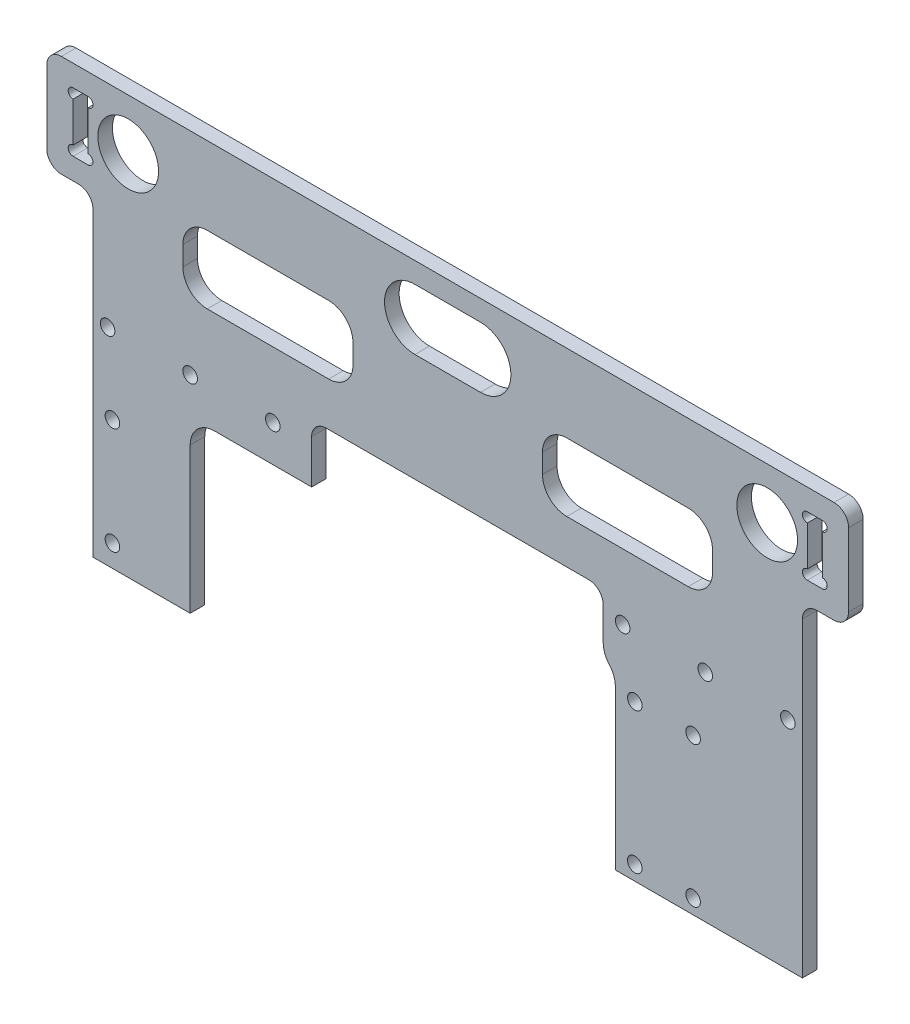
from build123d import *

# Parameters (mm, degrees)
SKETCH_1_W          = 165
SKETCH_1_H          = 51
EXTRUDE_1_DEPTH     = 3
SKETCH_2_R          = 1.5
CUT_EXTRUDE_1_DEPTH = 87.403124943
SKETCH_3_R          = 6.25
SKETCH_3_W          = 3.1
SKETCH_3_H          = 12.2
CUT_EXTRUDE_2_DEPTH = 87.403124943
SKETCH_5_W          = 9.5
SKETCH_5_H          = 30
CUT_EXTRUDE_4_DEPTH = 87.403124943
FILLET_1_R          = 3
SKETCH_6_W          = 20
SKETCH_6_H          = 35
SKETCH_6_W_2        = 38.5
SKETCH_6_H_2        = 37
EXTRUDE_2_DEPTH     = 3
SKETCH_4_R          = 1
CUT_EXTRUDE_3_DEPTH = 104.544676348
SKETCH_8_R          = 1.5
CUT_EXTRUDE_6_DEPTH = 104.544676348
FILLET_2_R          = 5
SKETCH_10_W         = 35
SKETCH_10_H         = 14
CUT_EXTRUDE_8_DEPTH = 104.544676348
FILLET_3_R          = 5
SKETCH_11_W         = 60
SKETCH_11_H         = 12
CUT_EXTRUDE_9_DEPTH = 104.544676348
FILLET_4_R          = 3
FILLET_5_R          = 5
FILLET_6_R          = 5


with BuildPart() as part:
    # 草图1 → 凸台-拉伸1 (new body)
    with BuildSketch(Plane.XY):
        Rectangle(SKETCH_1_W, SKETCH_1_H)
    extrude(amount=EXTRUDE_1_DEPTH)

    # 草图2 → 切除-拉伸1 (cut, through all)
    with BuildSketch(Plane.XY.offset(3)):
        with Locations((-53, -18)):
            Circle(SKETCH_2_R)
        with Locations((-36, -18)):
            Circle(SKETCH_2_R)
        with Locations(Location((36, -18, 0), (0, 0, 180))):
            Circle(SKETCH_2_R)
        with Locations(Location((53, -18, 0), (0, 0, 180))):
            Circle(SKETCH_2_R)
        with Locations((-70, -18)):
            Circle(SKETCH_2_R)
        with Locations(Location((70, -18, 0), (0, 0, 180))):
            Circle(SKETCH_2_R)
    extrude(amount=-CUT_EXTRUDE_1_DEPTH, mode=Mode.SUBTRACT)

    # 草图3 → 切除-拉伸2 (cut, through all)
    with BuildSketch(Plane.XY.offset(3)):
        with Locations((-65.75, 15)):
            Circle(SKETCH_3_R)
        with Locations(Location((65.75, 15, 0), (0, 0, 180))):
            Circle(SKETCH_3_R)
        with BuildLine():
            Line((-6.75, 21.25), (6.75, 21.25))
            ThreePointArc((6.75, 21.25), (13, 15), (6.75, 8.75))
            Line((6.75, 8.75), (-6.75, 8.75))
            ThreePointArc((-6.75, 8.75), (-13, 15), (-6.75, 21.25))
        make_face()
        with Locations((-75.55, 15)):
            Rectangle(SKETCH_3_W, SKETCH_3_H)
        with Locations((75.55, 15)):
            Rectangle(SKETCH_3_W, SKETCH_3_H)
    extrude(amount=-CUT_EXTRUDE_2_DEPTH, mode=Mode.SUBTRACT)

    # 草图5 → 切除-拉伸4 (cut, through all)
    with BuildSketch(Plane(origin=(0, 0, 0), x_dir=(-1, 0, 0), z_dir=(0, 0, -1))):
        with Locations((-77.75, -10.5)):
            Rectangle(SKETCH_5_W, SKETCH_5_H)
        with Locations((77.75, -10.5)):
            Rectangle(SKETCH_5_W, SKETCH_5_H)
    extrude(amount=-CUT_EXTRUDE_4_DEPTH, mode=Mode.SUBTRACT)

    # 圆角1
    fillet_1_edges = [part.edges().sort_by_distance(p)[0] for p in [
        (82.5, 4.5, 1.5),
        (73, 4.5, 1.5),
        (-73, 4.5, 1.5),
        (-82.5, 4.5, 1.5),
        (-82.5, 25.5, 1.5),
        (82.5, 25.5, 1.5),
    ]]
    fillet(fillet_1_edges, radius=FILLET_1_R)

    # 草图6 → 凸台-拉伸2 (add)
    with BuildSketch(Plane(origin=(0, 0, 0), x_dir=(-1, 0, 0), z_dir=(0, 0, -1))):
        with Locations((63, -43)):
            Rectangle(SKETCH_6_W, SKETCH_6_H)
        with Locations((-53.75, -44)):
            Rectangle(SKETCH_6_W_2, SKETCH_6_H_2)
    extrude(amount=-EXTRUDE_2_DEPTH)

    # 草图4 → 切除-拉伸3 (cut, through all)
    with BuildSketch(Plane.XY.offset(3)):
        with Locations((-74, 20.1)):
            Circle(SKETCH_4_R)
        with Locations((-74, 9.9)):
            Circle(SKETCH_4_R)
        with Locations((-77.1, 9.9)):
            Circle(SKETCH_4_R)
        with Locations((-77.1, 20.1)):
            Circle(SKETCH_4_R)
        with Locations((77.1, 20.1)):
            Circle(SKETCH_4_R)
        with Locations((77.1, 9.9)):
            Circle(SKETCH_4_R)
        with Locations((74, 9.9)):
            Circle(SKETCH_4_R)
        with Locations((74, 20.1)):
            Circle(SKETCH_4_R)
    extrude(amount=-CUT_EXTRUDE_3_DEPTH, mode=Mode.SUBTRACT)

    # 草图8 → 切除-拉伸6 (cut, through all)
    with BuildSketch(Plane.XY.offset(3)):
        with Locations((-69, -56)):
            Circle(SKETCH_8_R)
        with Locations((-69, -34)):
            Circle(SKETCH_8_R)
        with Locations((38.5, -30.5)):
            Circle(SKETCH_8_R)
        with Locations((38.5, -59.5)):
            Circle(SKETCH_8_R)
        with Locations((50.5, -59.5)):
            Circle(SKETCH_8_R)
        with Locations((50.5, -30.5)):
            Circle(SKETCH_8_R)
    extrude(amount=-CUT_EXTRUDE_6_DEPTH, mode=Mode.SUBTRACT)

    # 圆角2
    fillet_2_edges = [part.edges().sort_by_distance(p)[0] for p in [
        (-53, -25.5, 1.5),
    ]]
    fillet(fillet_2_edges, radius=FILLET_2_R)

    # 草图10 → 切除-拉伸8 (cut, through all)
    with BuildSketch(Plane.XY.offset(3)):
        with Locations((37, 2.5)):
            Rectangle(SKETCH_10_W, SKETCH_10_H)
        with Locations((-37, 2.5)):
            Rectangle(SKETCH_10_W, SKETCH_10_H)
    extrude(amount=-CUT_EXTRUDE_8_DEPTH, mode=Mode.SUBTRACT)

    # 圆角3
    fillet_3_edges = [part.edges().sort_by_distance(p)[0] for p in [
        (-19.5, 9.5, 1.5),
        (-19.5, -4.5, 1.5),
        (-54.5, -4.5, 1.5),
        (-54.5, 9.5, 1.5),
        (54.5, 9.5, 1.5),
        (54.5, -4.5, 1.5),
        (19.5, -4.5, 1.5),
        (19.5, 9.5, 1.5),
    ]]
    fillet(fillet_3_edges, radius=FILLET_3_R)

    # 草图11 → 切除-拉伸9 (cut, through all)
    with BuildSketch(Plane.XY.offset(3)):
        with Locations((2, -19.5)):
            Rectangle(SKETCH_11_W, SKETCH_11_H)
    extrude(amount=-CUT_EXTRUDE_9_DEPTH, mode=Mode.SUBTRACT)

    # 圆角4
    fillet_4_edges = [part.edges().sort_by_distance(p)[0] for p in [
        (-28, -13.5, 1.5),
        (32, -13.5, 1.5),
    ]]
    fillet(fillet_4_edges, radius=FILLET_4_R)

    # 圆角5
    # the kernel refuses this fillet: 5 mm, written as the material it adds along each edge
    with BuildSketch(Plane(origin=(34.5, -25.5, 0), x_dir=(-1, 0, 0), z_dir=(0, 0, 1))) as fillet_5_piece_1:
        with BuildLine():
            CenterArc((5, 4.330127019), FILLET_5_R, 180, 60)
            Line((0, 4.330127019), (-0.1, 4.330127019))
            Line((-0.1, 4.330127019), (-0.1, 0))
            Line((-0.1, 0), (0, -0.1))
            ThreePointArc((0, -0.1), (1.25, -0.1), (2.45, -0.08660254))
            Line((2.45, -0.08660254), (2.5, 0))
        make_face()
    extrude(amount=3)

    # 圆角6
    fillet_6_edges = [part.edges().sort_by_distance(p)[0] for p in [
        (32, -25.5, 1.5),
    ]]
    fillet(fillet_6_edges, radius=FILLET_6_R)


solid = part.part
